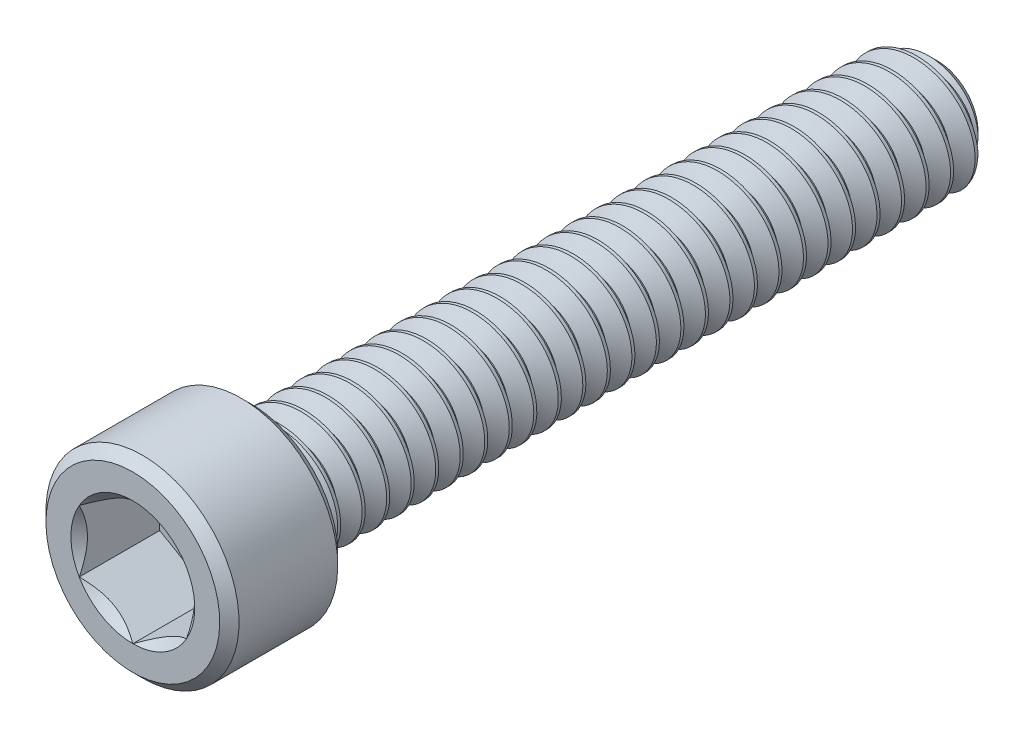
from build123d import *

# Parameters (mm, degrees)
CHAMFER1_SIZE      = 0.17859375
CHAMFER2_SIZE      = 0.340178571
CUT_EXTRUDE1_DEPTH = 1.48828125
CUT_SWEEP1_PITCH   = 0.453571429
CUT_SWEEP1_TO      = 12.7


with BuildPart() as part:
    # Sketch3 → Revolve1 (revolve)
    with BuildSketch(Plane(origin=(0, 0, 0), x_dir=(0, 0, -1), z_dir=(1, 0, 0)), mode=Mode.PRIVATE) as revolve1_sk:
        Polygon((0, 0), (14.8844, 0), (14.8844, 1.0922), (2.1844, 1.0922), (2.1844, 1.7859375), (0, 1.7859375), align=None)
    revolve(revolve1_sk.sketch.rotate(Axis((0, 0, 0), (0, 0, -1)), 180), axis=Axis((0, 0, 0), (0, 0, -1)))

    # Chamfer1
    chamfer1_edges = [part.edges().sort_by_distance(p)[0] for p in [
        (0, 1.7859375, -2.1844),
        (0, 1.7859375, 0),
    ]]
    chamfer(chamfer1_edges, length=CHAMFER1_SIZE)

    # Chamfer2
    chamfer2_edges = [part.edges().sort_by_distance(p)[0] for p in [
        (0, 1.0922, -14.8844),
    ]]
    chamfer(chamfer2_edges, length=CHAMFER2_SIZE)

    # Sketch4 → Cut-Extrude1 (cut)
    with BuildSketch(Plane.XY):
        Polygon((-0.9921875, -0.57283972), (0, -1.14567944), (0.9921875, -0.57283972), (0.9921875, 0.57283972), (0, 1.14567944), (-0.9921875, 0.57283972), align=None)
    extrude(amount=-CUT_EXTRUDE1_DEPTH, mode=Mode.SUBTRACT)

    # Cut-Extrude2 cone 1 section (through the dimple's axis) → Cut-Extrude2 (revolve, cut)
    with BuildSketch(Plane(origin=(0, 0, 0), x_dir=(0, -1, 0), z_dir=(1, 0, 0))):
        Polygon((0, 0), (1.14567944, 0), (0, 1.14567944), align=None)
    revolve(axis=Axis((0, 0, 0), (0, 0, -1)), mode=Mode.SUBTRACT)


with BuildPart() as body_2:
    # Split1: read off the stored shape, not the designer's step
    # Split1: the piece on the far side of the plane
    add(part.part)
    split(bisect_by=Plane.XY.offset(-2.1844), keep=Keep.BOTTOM)

    # Cut-Sweep1: arcs per turn and ends read off the stored shape
    # Cut-Sweep1: the profile of Sketch7 profile screwed along a right-hand helix through 29 turns, 6 arcs to a turn; built about Z, then put on its axis
    cut_sweep1_z = Axis((0, 0, 0), (0, 0, 1))
    cut_sweep1_corners = [(1.0925, 0, 0.000173205), (1.0925, 0, -0.397048205), (0.797596715, 0, -0.226785714), (0.797596715, 0, -0.170089286)]
    with BuildLine(mode=Mode.PRIVATE) as cut_sweep1_profile:
        Line(cut_sweep1_corners[0], cut_sweep1_corners[1])
        Line(cut_sweep1_corners[1], cut_sweep1_corners[2])
        Line(cut_sweep1_corners[2], cut_sweep1_corners[3])
        Line(cut_sweep1_corners[3], cut_sweep1_corners[0])
    cut_sweep1_cap = Face(cut_sweep1_profile.wire())
    cut_sweep1_turn_angles = [0, 30, 60, 90, 120, 150, 180, 210, 240, 270, 300, 330, 360]
    cut_sweep1_turn_weights = [1, 0.8660254037844387, 1, 0.8660254037844387, 1, 0.8660254037844387, 1, 0.8660254037844387, 1, 0.8660254037844387, 1, 0.8660254037844387, 1]
    cut_sweep1_turn_rails = [Edge.make_bspline([Vector(p[0], p[1], 0).rotate(cut_sweep1_z, cut_sweep1_turn_angles[k]) / cut_sweep1_turn_weights[k] + Vector(0, 0, p[2] + CUT_SWEEP1_PITCH * cut_sweep1_turn_angles[k] / 360) for k in range(13)], [0, 0, 0, 1, 1, 2, 2, 3, 3, 4, 4, 5, 5, 6, 6, 6], 2, cut_sweep1_turn_weights) for p in cut_sweep1_corners]
    cut_sweep1_turn_sides = [Face.make_surface_from_curves(cut_sweep1_turn_rails[p[0]], cut_sweep1_turn_rails[p[1]]) for p in [(0, 1), (1, 2), (2, 3), (3, 0)]]
    cut_sweep1 = Plane(origin=(0, 0, -14.8844), x_dir=(0, 1, 0), z_dir=(0, 0, 1)) * split(Solid(Shell([*[p.moved(Location((0, 0, CUT_SWEEP1_PITCH * i))) for i in range(29) for p in cut_sweep1_turn_sides], cut_sweep1_cap, cut_sweep1_cap.rotate(cut_sweep1_z, 10440).moved(Location((0, 0, CUT_SWEEP1_PITCH * 10440 / 360)))])), bisect_by=Plane.XY.offset(CUT_SWEEP1_TO), keep=Keep.BOTTOM, mode=Mode.PRIVATE)
    add(cut_sweep1, mode=Mode.SUBTRACT)


with BuildPart() as part_1:
    add(part.part)

    # Split1
    split(bisect_by=Plane.XY.offset(-2.1844), keep=Keep.TOP)


with BuildPart() as body_2_1:
    add(body_2.part)

    # Combine1: union part
    add(part_1.part)


solid = body_2_1.part
